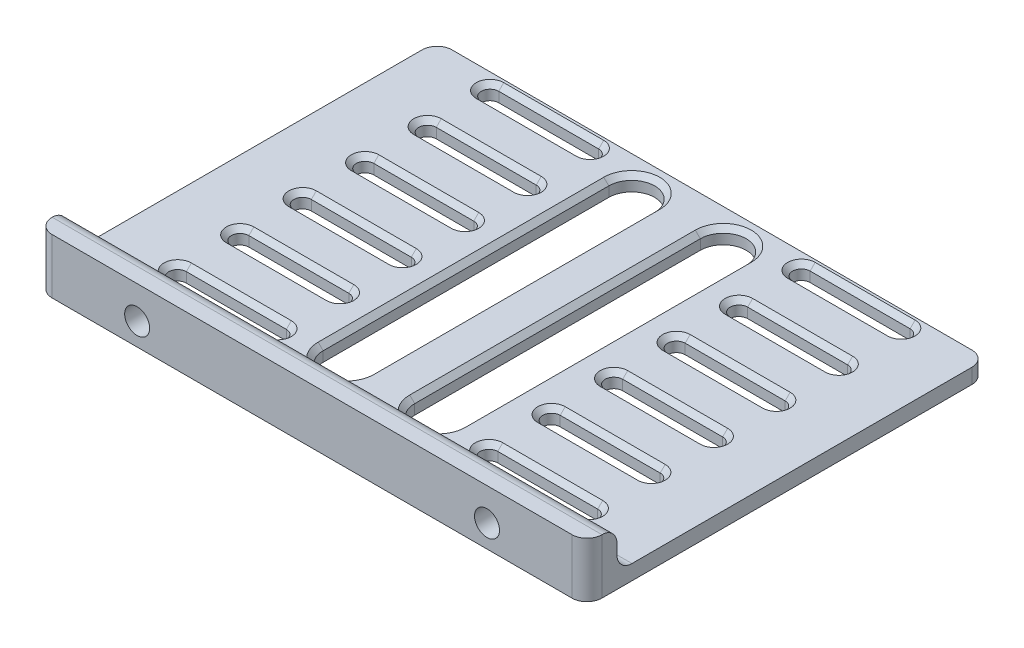
from build123d import *

# Parameters (mm, degrees)
SKETCH1_W                        = 110
SKETCH1_H                        = 80
BOSS_EXTRUDE1_DEPTH              = 3
SKETCH2_W                        = 110
SKETCH2_H                        = 6
BOSS_EXTRUDE2_DEPTH              = 8
F_1_8_27_NPSM_TAPPED_HOLE1_D     = 5
F_1_8_27_NPSM_TAPPED_HOLE1_DEPTH = 6
F_1_8_27_NPSM_TAPPED_HOLE1_TIP   = 1.502151548
FILLET1_R                        = 3
CUT_EXTRUDE1_DEPTH               = 8
LPATTERN1_COUNT                  = 6
LPATTERN1_PITCH                  = 12.5
CUT_EXTRUDE2_DEPTH               = 8
FILLET2_R                        = 3
CHAMFER1_SIZE                    = 1


with BuildPart() as part:
    # Sketch1 → Boss-Extrude1 (new body)
    with BuildSketch(Plane(origin=(0, 0, 0), x_dir=(1, 0, 0), z_dir=(0, 1, 0))):
        Rectangle(SKETCH1_W, SKETCH1_H)
    extrude(amount=BOSS_EXTRUDE1_DEPTH)

    # Sketch2 → Boss-Extrude2 (add)
    with BuildSketch(Plane(origin=(0, 3, 0), x_dir=(1, 0, 0), z_dir=(0, 1, 0))):
        with Locations((0, -37)):
            Rectangle(SKETCH2_W, SKETCH2_H)
    extrude(amount=BOSS_EXTRUDE2_DEPTH)

    # 1/8-27 NPSM Tapped Hole1
    with Locations(Plane.XY.offset(40)):
        with Locations((-35, 4.5), (35, 4.5)):
            Hole(F_1_8_27_NPSM_TAPPED_HOLE1_D / 2, depth=F_1_8_27_NPSM_TAPPED_HOLE1_DEPTH)
            with Locations((0, 0, -(F_1_8_27_NPSM_TAPPED_HOLE1_DEPTH + F_1_8_27_NPSM_TAPPED_HOLE1_TIP / 2))):  # 118° drill point
                Cone(0, F_1_8_27_NPSM_TAPPED_HOLE1_D / 2, F_1_8_27_NPSM_TAPPED_HOLE1_TIP, mode=Mode.SUBTRACT)

    # Fillet1
    # the kernel refuses this fillet: 3 mm, written as the material it adds along each edge
    with BuildSketch(Plane(origin=(55, 3, 34), x_dir=(0, 0, -1), z_dir=(-1, 0, 0))) as fillet1_piece_1_section:
        with BuildLine():
            CenterArc((FILLET1_R, -FILLET1_R), FILLET1_R, 90, 90)
            Line((0, -FILLET1_R), (0, 0))
            Line((0, 0), (FILLET1_R, 0))
        make_face()
    fillet1_piece_1 = extrude(amount=25.5, mode=Mode.PRIVATE)
    fillet1_piece_1 = fillet1_piece_1 - Plane(origin=(35, 4.5, 33.326842019), x_dir=(-1, 0, 0), z_dir=(0, 0, -1)) * Cylinder(2.5, 64, mode=Mode.PRIVATE)
    add(fillet1_piece_1)
    with BuildSketch(Plane(origin=(40.5, 3, 34), x_dir=(0, 0, -1), z_dir=(-1, 0, 0))) as fillet1_piece_2_section:
        with BuildLine():
            CenterArc((FILLET1_R, -FILLET1_R), FILLET1_R, 90, 90)
            Line((0, -FILLET1_R), (0, 0))
            Line((0, 0), (FILLET1_R, 0))
        make_face()
    fillet1_piece_2 = extrude(amount=81, mode=Mode.PRIVATE)
    fillet1_piece_2 = fillet1_piece_2 - Plane(origin=(35, 4.5, 33.313079734), x_dir=(-1, 0, 0), z_dir=(0, 0, -1)) * Cylinder(2.5, 175, mode=Mode.PRIVATE)
    fillet1_piece_2 = fillet1_piece_2 - Plane(origin=(-35, 4.5, 33.313079734), x_dir=(-1, 0, 0), z_dir=(0, 0, -1)) * Cylinder(2.5, 175, mode=Mode.PRIVATE)
    add(fillet1_piece_2)
    with BuildSketch(Plane(origin=(-29.5, 3, 34), x_dir=(0, 0, -1), z_dir=(-1, 0, 0))) as fillet1_piece_3_section:
        with BuildLine():
            CenterArc((FILLET1_R, -FILLET1_R), FILLET1_R, 90, 90)
            Line((0, -FILLET1_R), (0, 0))
            Line((0, 0), (FILLET1_R, 0))
        make_face()
    fillet1_piece_3 = extrude(amount=25.5, mode=Mode.PRIVATE)
    fillet1_piece_3 = fillet1_piece_3 - Plane(origin=(-35, 4.5, 33.313079734), x_dir=(-1, 0, 0), z_dir=(0, 0, -1)) * Cylinder(2.5, 63, mode=Mode.PRIVATE)
    add(fillet1_piece_3)
    # the kernel refuses this fillet: 3 mm, written as the material it takes off along each edge
    with BuildSketch(Plane(origin=(62.5, 11, 34), x_dir=(0, -1, 0), z_dir=(-1, 0, 0))) as fillet1_2_piece_1:
        with BuildLine():
            CenterArc((FILLET1_R, FILLET1_R), FILLET1_R, 180, 90)
            Line((0, FILLET1_R), (0, 0))
            Line((0, 0), (FILLET1_R, 0))
        make_face()
    extrude(amount=125, mode=Mode.SUBTRACT)

    # Sketch6 → Cut-Extrude1 (cut)
    with BuildSketch(Plane(origin=(0, 3, 0), x_dir=(1, 0, 0), z_dir=(0, 1, 0))):
        with BuildLine():
            Line((-41.150032335, -24), (-21.150032335, -24))
            ThreePointArc((-21.150032335, -24), (-19.400032335, -25.75), (-21.150032335, -27.5))
            Line((-21.150032335, -27.5), (-41.150032335, -27.5))
            ThreePointArc((-41.150032335, -27.5), (-42.900032335, -25.75), (-41.150032335, -24))
        make_face()
        with BuildLine():
            Line((41.150032335, -24), (21.150032335, -24))
            ThreePointArc((21.150032335, -24), (19.400032335, -25.75), (21.150032335, -27.5))
            Line((21.150032335, -27.5), (41.150032335, -27.5))
            ThreePointArc((41.150032335, -27.5), (42.900032335, -25.75), (41.150032335, -24))
        make_face()
    cut_extrude1 = extrude(amount=-CUT_EXTRUDE1_DEPTH, mode=Mode.SUBTRACT)

    # LPattern1: Cut-Extrude1 ×6
    with Locations(*[(0, 0, -i * LPATTERN1_PITCH) for i in range(1, LPATTERN1_COUNT)]):
        add(cut_extrude1, mode=Mode.SUBTRACT)

    # Sketch7 → Cut-Extrude2 (cut)
    with BuildSketch(Plane(origin=(0, 3, 0), x_dir=(1, 0, 0), z_dir=(0, 1, 0))):
        with BuildLine():
            Line((-13.750692764, -24.031822976), (-13.750692764, 33.113913187))
            ThreePointArc((-13.750692764, 33.113913187), (-9.15862468, 37.705981272), (-4.566556595, 33.113913187))
            Line((-4.566556595, 33.113913187), (-4.566556595, -24.031822976))
            ThreePointArc((-4.566556595, -24.031822976), (-9.15862468, -28.62389106), (-13.750692764, -24.031822976))
        make_face()
        with BuildLine():
            Line((13.750692764, -24.031822976), (13.750692764, 33.113913187))
            ThreePointArc((13.750692764, 33.113913187), (9.15862468, 37.705981272), (4.566556595, 33.113913187))
            Line((4.566556595, 33.113913187), (4.566556595, -24.031822976))
            ThreePointArc((4.566556595, -24.031822976), (9.15862468, -28.62389106), (13.750692764, -24.031822976))
        make_face()
    extrude(amount=-CUT_EXTRUDE2_DEPTH, mode=Mode.SUBTRACT)

    # Fillet2
    fillet2_edges = [part.edges().sort_by_distance(p)[0] for p in [
        (-55, 5.5, 40),
        (55, 5.5, 40),
        (55, 1.5, -40),
        (-55, 1.5, -40),
    ]]
    fillet(fillet2_edges, radius=FILLET2_R)

    # Chamfer1
    chamfer1_edges = [part.edges().sort_by_distance(p)[0] for p in [
        (-42.900032335, 3, 25.75),
        (-31.150032335, 3, 27.5),
        (-19.400032335, 3, 25.75),
        (-31.150032335, 3, 24),
        (42.900032335, 3, 25.75),
        (31.150032335, 3, 24),
        (19.400032335, 3, 25.75),
        (31.150032335, 3, 27.5),
        (-42.900032335, 3, 13.25),
        (-31.150032335, 3, 15),
        (-19.400032335, 3, 13.25),
        (-31.150032335, 3, 11.5),
        (-42.900032335, 3, 0.75),
        (-31.150032335, 3, -1),
        (-19.400032335, 3, 0.75),
        (-31.150032335, 3, 2.5),
        (-42.900032335, 3, -11.75),
        (-31.150032335, 3, -13.5),
        (-19.400032335, 3, -11.75),
        (-31.150032335, 3, -10),
        (-42.900032335, 3, -24.25),
        (-31.150032335, 3, -26),
        (-19.400032335, 3, -24.25),
        (-31.150032335, 3, -22.5),
        (-42.900032335, 3, -36.75),
        (-31.150032335, 3, -38.5),
        (-19.400032335, 3, -36.75),
        (-31.150032335, 3, -35),
        (42.900032335, 3, 13.25),
        (31.150032335, 3, 11.5),
        (19.400032335, 3, 13.25),
        (31.150032335, 3, 15),
        (42.900032335, 3, 0.75),
        (31.150032335, 3, 2.5),
        (19.400032335, 3, 0.75),
        (31.150032335, 3, -1),
        (42.900032335, 3, -11.75),
        (31.150032335, 3, -10),
        (19.400032335, 3, -11.75),
        (31.150032335, 3, -13.5),
        (42.900032335, 3, -24.25),
        (31.150032335, 3, -22.5),
        (19.400032335, 3, -24.25),
        (31.150032335, 3, -26),
        (42.900032335, 3, -36.75),
        (31.150032335, 3, -35),
        (19.400032335, 3, -36.75),
        (31.150032335, 3, -38.5),
        (-9.15862468, 3, 28.62389106),
        (-4.566556595, 3, -4.541045106),
        (-9.15862468, 3, -37.705981272),
        (-13.750692764, 3, -4.541045106),
        (9.15862468, 3, 28.62389106),
        (13.750692764, 3, -4.541045106),
        (9.15862468, 3, -37.705981272),
        (4.566556595, 3, -4.541045106),
    ]]
    chamfer(chamfer1_edges, length=CHAMFER1_SIZE)


solid = part.part
